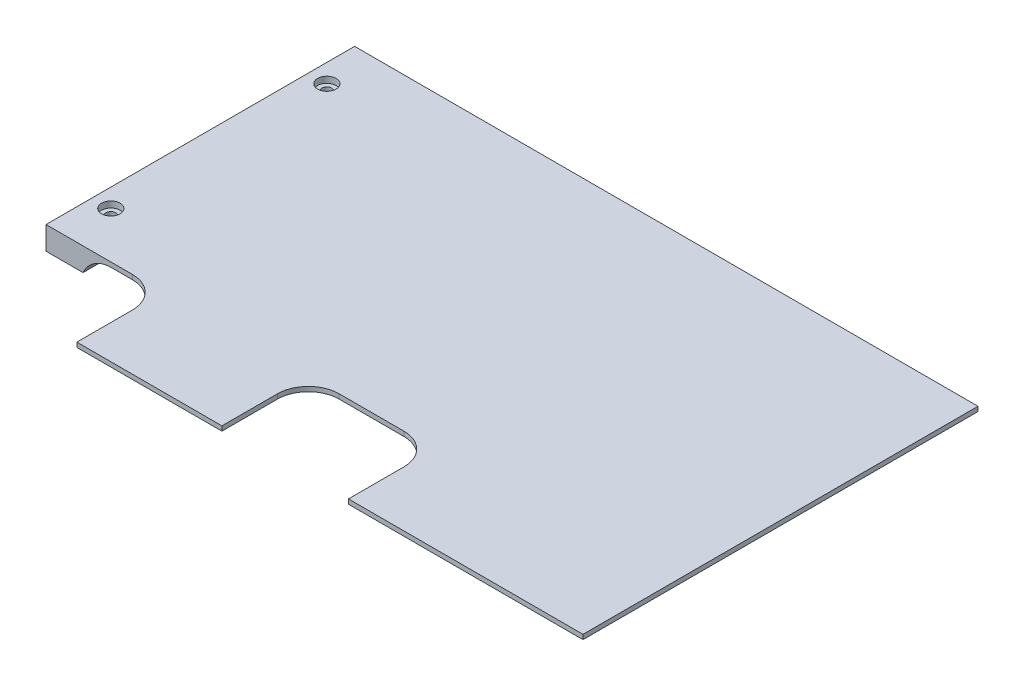
from build123d import *

# Parameters (mm, degrees)
CROQUIS1_W              = 202
CROQUIS1_H              = 100
SALIENTE_EXTRUIR1_DEPTH = 1.5
CROQUIS2_R              = 1.6
CORTAR_EXTRUIR1_DEPTH   = 1.5
CROQUIS3_W              = 12
CROQUIS3_H              = 100
CROQUIS3_R              = 1.6
SALIENTE_EXTRUIR2_DEPTH = 6
CROQUIS4_W              = 47
CROQUIS4_H              = 28
CROQUIS4_W_2            = 76
SALIENTE_EXTRUIR3_DEPTH = 1.5
REDONDEO1_R             = 10
REDONDEO2_R             = 10
CROQUIS5_R              = 3
CORTAR_EXTRUIR2_DEPTH   = 2


with BuildPart() as part:
    # Croquis1 → Saliente-Extruir1 (new body)
    with BuildSketch(Plane(origin=(0, 0, 0), x_dir=(1, 0, 0), z_dir=(0, 1, 0))):
        with Locations((101, 50)):
            Rectangle(CROQUIS1_W, CROQUIS1_H)
    extrude(amount=SALIENTE_EXTRUIR1_DEPTH)

    # Croquis2 → Cortar-Extruir1 (cut)
    with BuildSketch(Plane(origin=(0, 1.5, 0), x_dir=(1, 0, 0), z_dir=(0, 1, 0))):
        with Locations(Location((6, 85, 0), (0, 0, 270))):
            Circle(CROQUIS2_R)
        with Locations(Location((6, 15, 0), (0, 0, 270))):
            Circle(CROQUIS2_R)
    extrude(amount=-CORTAR_EXTRUIR1_DEPTH, mode=Mode.SUBTRACT)

    # Croquis3 → Saliente-Extruir2 (add)
    with BuildSketch(Plane.XZ):
        with Locations((6, -50)):
            Rectangle(CROQUIS3_W, CROQUIS3_H)
        with Locations(Location((6, -15, 0), (0, 0, 90))):
            Circle(CROQUIS3_R, mode=Mode.SUBTRACT)
        with Locations(Location((6, -85, 0), (0, 0, 90))):
            Circle(CROQUIS3_R, mode=Mode.SUBTRACT)
    extrude(amount=SALIENTE_EXTRUIR2_DEPTH)

    # Croquis4 → Saliente-Extruir3 (add)
    with BuildSketch(Plane(origin=(0, 1.5, 0), x_dir=(1, 0, 0), z_dir=(0, 1, 0))):
        with Locations((61.5, -14)):
            Rectangle(CROQUIS4_W, CROQUIS4_H)
        with Locations((164, -14)):
            Rectangle(CROQUIS4_W_2, CROQUIS4_H)
    extrude(amount=-SALIENTE_EXTRUIR3_DEPTH)

    # Redondeo1
    redondeo1_edges = [part.edges().sort_by_distance(p)[0] for p in [
        (85, 0.75, 0),
        (38, 0.75, 0),
        (126, 0.75, 0),
    ]]
    fillet(redondeo1_edges, radius=REDONDEO1_R)

    # Redondeo2
    # the kernel refuses this fillet: 10 mm, written as the material it adds along each edge
    with BuildSketch(Plane(origin=(12, 0, -100), x_dir=(0, -1, 0), z_dir=(0, 0, 1))) as redondeo2_piece_1:
        with BuildLine():
            CenterArc((10, 9.16515139), REDONDEO2_R, 180, 66.421821522)
            Line((0, 9.16515139), (-0.2, 9.16515139))
            Line((-0.2, 9.16515139), (-0.2, 0))
            Line((-0.2, 0), (0, -0.2))
            ThreePointArc((0, -0.2), (3, -0.2), (5.92, -0.183303028))
            Line((5.92, -0.183303028), (6, 0))
        make_face()
    extrude(amount=100)

    # Croquis5 → Cortar-Extruir2 (cut)
    with BuildSketch(Plane(origin=(0, 1.5, 0), x_dir=(1, 0, 0), z_dir=(0, 1, 0))):
        with Locations(Location((6, 85, 0), (0, 0, 270))):
            Circle(CROQUIS5_R)
        with Locations(Location((6, 15, 0), (0, 0, 270))):
            Circle(CROQUIS5_R)
    extrude(amount=-CORTAR_EXTRUIR2_DEPTH, mode=Mode.SUBTRACT)


solid = part.part
